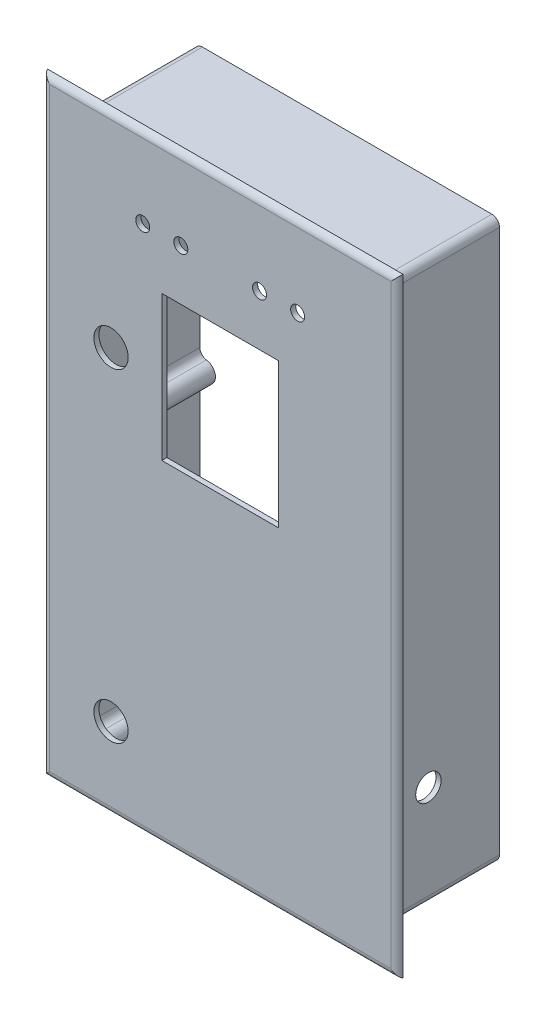
from build123d import *

# Parameters (mm, degrees)
SKETCH1_W           = 120
SKETCH1_H           = 220
BOSS_EXTRUDE1_DEPTH = 48
SKETCH2_W           = 140
SKETCH2_H           = 240
BOSS_EXTRUDE2_DEPTH = 2
SHELL3_DEPTH        = 48
FILLET1_R           = 3
SKETCH4_R           = 2.75
SKETCH4_R_2         = 6.75
SKETCH4_W           = 46
SKETCH4_H           = 57
CUT_EXTRUDE1_DEPTH  = 147.982992213
SKETCH6_R           = 1.2
BOSS_EXTRUDE3_DEPTH = 15
SKETCH7_R           = 2.5
BOSS_EXTRUDE4_DEPTH = 8
CUT_EXTRUDE2_REACH  = 185.848
SKETCH9_R           = 5
CUT_EXTRUDE3_REACH  = 185.848
SKETCH10_R          = 5
CUT_EXTRUDE4_REACH  = 247.561
SKETCH11_R          = 6.75
FILLET2_R           = 3
FILLET3_R           = 3


# Read off the part's stored shape, not the designer's step: Ø3.0mm Dowel Hole1, Shell3
with BuildPart() as part:
    # Sketch1 → Boss-Extrude1 (new body)
    with BuildSketch(Plane.XY):
        Rectangle(SKETCH1_W, SKETCH1_H)
    extrude(amount=BOSS_EXTRUDE1_DEPTH)

    # Sketch2 → Boss-Extrude2 (add)
    with BuildSketch(Plane.XY.offset(48)):
        Rectangle(SKETCH2_W, SKETCH2_H)
    extrude(amount=BOSS_EXTRUDE2_DEPTH)

    # Ø3.0mm Dowel Hole1 outline → Ø3.0mm Dowel Hole1 (revolve, cut)
    with BuildSketch(Plane(origin=(-56, 0, 0), x_dir=(1, 0, 0), z_dir=(0, -1, 0))):
        Polygon((2.125, 48), (0, 49.276828815), (0, 0), (2.125, 0), align=None)
    revolve(axis=Axis((-56, 0, 0), (0, 0, 1)), mode=Mode.SUBTRACT)

    # 3.0mm Dowel Hole1 2 outline → 3.0mm Dowel Hole1 2 (revolve, cut)
    with BuildSketch(Plane(origin=(56, 0, 0), x_dir=(1, 0, 0), z_dir=(0, -1, 0))):
        Polygon((2.125, 48), (0, 49.276828815), (0, 0), (2.125, 0), align=None)
    revolve(axis=Axis((56, 0, 0), (0, 0, 1)), mode=Mode.SUBTRACT)

    # 3.0mm Dowel Hole1 3 outline → 3.0mm Dowel Hole1 3 (revolve, cut)
    with BuildSketch(Plane(origin=(-56, -106, 0), x_dir=(1, 0, 0), z_dir=(0, -1, 0))):
        Polygon((2.125, 48), (0, 49.276828815), (0, 0), (2.125, 0), align=None)
    revolve(axis=Axis((-56, -106, 0), (0, 0, 1)), mode=Mode.SUBTRACT)

    # 3.0mm Dowel Hole1 4 outline → 3.0mm Dowel Hole1 4 (revolve, cut)
    with BuildSketch(Plane(origin=(56, -106, 0), x_dir=(1, 0, 0), z_dir=(0, -1, 0))):
        Polygon((2.125, 48), (0, 49.276828815), (0, 0), (2.125, 0), align=None)
    revolve(axis=Axis((56, -106, 0), (0, 0, 1)), mode=Mode.SUBTRACT)

    # 3.0mm Dowel Hole1 5 outline → 3.0mm Dowel Hole1 5 (revolve, cut)
    with BuildSketch(Plane(origin=(-56, 106, 0), x_dir=(1, 0, 0), z_dir=(0, -1, 0))):
        Polygon((2.125, 48), (0, 49.276828815), (0, 0), (2.125, 0), align=None)
    revolve(axis=Axis((-56, 106, 0), (0, 0, 1)), mode=Mode.SUBTRACT)

    # 3.0mm Dowel Hole1 6 outline → 3.0mm Dowel Hole1 6 (revolve, cut)
    with BuildSketch(Plane(origin=(56, 106, 0), x_dir=(1, 0, 0), z_dir=(0, -1, 0))):
        Polygon((2.125, 48), (0, 49.276828815), (0, 0), (2.125, 0), align=None)
    revolve(axis=Axis((56, 106, 0), (0, 0, 1)), mode=Mode.SUBTRACT)

    # Shell3 outline → Shell3 (cut)
    with BuildSketch(Plane.XY):
        with BuildLine():
            Line((52.392282578, 108), (-52.392282578, 108))
            ThreePointArc((-52.392282578, 108), (-53.083184528, 103.083184528), (-58, 102.392282578))
            Line((-58, 102.392282578), (-58, 3.607717422))
            ThreePointArc((-58, 3.607717422), (-51.875, 0), (-58, -3.607717422))
            Line((-58, -3.607717422), (-58, -102.392282578))
            ThreePointArc((-58, -102.392282578), (-53.083184528, -103.083184528), (-52.392282578, -108))
            Line((-52.392282578, -108), (52.392282578, -108))
            ThreePointArc((52.392282578, -108), (53.083184528, -103.083184528), (58, -102.392282578))
            Line((58, -102.392282578), (58, -3.607717422))
            ThreePointArc((58, -3.607717422), (51.875, 0), (58, 3.607717422))
            Line((58, 3.607717422), (58, 102.392282578))
            ThreePointArc((58, 102.392282578), (53.083184528, 103.083184528), (52.392282578, 108))
        make_face()
    extrude(amount=SHELL3_DEPTH, mode=Mode.SUBTRACT)

    # Fillet1
    fillet1_edges = [part.edges().sort_by_distance(p)[0] for p in [
        (-52.392282578, 108, 24),
        (-58, 3.607717422, 24),
        (58, -3.607717422, 24),
        (52.392282578, -108, 24),
        (58, 102.392282578, 24),
        (-58, -102.392282578, 24),
        (-58, -3.607717422, 24),
        (58, 3.607717422, 24),
        (-52.392282578, -108, 24),
        (58, -102.392282578, 24),
        (-58, 102.392282578, 24),
        (52.392282578, 108, 24),
    ]]
    fillet(fillet1_edges, radius=FILLET1_R)

    # Sketch4 → Cut-Extrude1 (cut, through all)
    with BuildSketch(Plane(origin=(0, 0, 48), x_dir=(-1, 0, 0), z_dir=(0, 0, -1))):
        with Locations((15.5, 88)):
            Circle(SKETCH4_R)
        with Locations(Location((30.5, 88, 0), (0, 0, 180))):
            Circle(SKETCH4_R)
        with Locations((-30.5, 88)):
            Circle(SKETCH4_R)
        with Locations(Location((-15.5, 88, 0), (0, 0, 180))):
            Circle(SKETCH4_R)
        with Locations((43, 39.5)):
            Circle(SKETCH4_R_2)
        with Locations((43, -88)):
            Circle(SKETCH4_R_2)
        with Locations((0, 39.5)):
            Rectangle(SKETCH4_W, SKETCH4_H)
    extrude(amount=-CUT_EXTRUDE1_DEPTH, mode=Mode.SUBTRACT)

    # Sketch6 → Boss-Extrude3 (add)
    with BuildSketch(Plane(origin=(0, 0, 48), x_dir=(-1, 0, 0), z_dir=(0, 0, -1))):
        with Locations(Location((-45.079, -23.120003999, 0), (0, 0, 180))):
            Circle(SKETCH6_R)
        with Locations(Location((24.517, -23.120003999, 0), (0, 0, 180))):
            Circle(SKETCH6_R)
        with Locations(Location((-45.079, -92.589003999, 0), (0, 0, 180))):
            Circle(SKETCH6_R)
        with Locations(Location((24.517, -92.589003999, 0), (0, 0, 180))):
            Circle(SKETCH6_R)
    extrude(amount=BOSS_EXTRUDE3_DEPTH)

    # Sketch7 → Boss-Extrude4 (add)
    with BuildSketch(Plane(origin=(0, 0, 48), x_dir=(-1, 0, 0), z_dir=(0, 0, -1))):
        with Locations(Location((-45.079, -23.120003999, 0), (0, 0, 180))):
            Circle(SKETCH7_R)
        with Locations(Location((24.517, -23.120003999, 0), (0, 0, 180))):
            Circle(SKETCH7_R)
        with Locations(Location((24.517, -92.589003999, 0), (0, 0, 180))):
            Circle(SKETCH7_R)
        with Locations(Location((-45.079, -92.589003999, 0), (0, 0, 180))):
            Circle(SKETCH7_R)
    extrude(amount=BOSS_EXTRUDE4_DEPTH)

    # Sketch9 → Cut-Extrude2 (cut, up to next)
    with BuildSketch(Plane(origin=(60, 0, 0), x_dir=(0, 0, -1), z_dir=(1, 0, 0)), mode=Mode.PRIVATE) as cut_extrude2_sk1:
        with Locations((-28, -70)):
            Circle(SKETCH9_R)
    cut_extrude2_tool1 = extrude(cut_extrude2_sk1.sketch, amount=-CUT_EXTRUDE2_REACH, mode=Mode.PRIVATE) & part.part
    add(cut_extrude2_tool1.solids().sort_by_distance((60, -70, 28))[0], mode=Mode.SUBTRACT)

    # Sketch10 → Cut-Extrude3 (cut, up to next)
    with BuildSketch(Plane.ZY.offset(60), mode=Mode.PRIVATE) as cut_extrude3_sk1:
        with Locations((28, -40)):
            Circle(SKETCH10_R)
    cut_extrude3_tool1 = extrude(cut_extrude3_sk1.sketch, amount=-CUT_EXTRUDE3_REACH, mode=Mode.PRIVATE) & part.part
    add(cut_extrude3_tool1.solids().sort_by_distance((-60, -40, 28))[0], mode=Mode.SUBTRACT)

    # Sketch11 → Cut-Extrude4 (cut, up to next)
    with BuildSketch(Plane.XZ.offset(110), mode=Mode.PRIVATE) as cut_extrude4_sk1:
        with Locations(Location((0, 30, 0), (0, 0, 270))):
            Circle(SKETCH11_R)
    cut_extrude4_tool1 = extrude(cut_extrude4_sk1.sketch, amount=-CUT_EXTRUDE4_REACH, mode=Mode.PRIVATE) & part.part
    add(cut_extrude4_tool1.solids().sort_by_distance((0, -110, 30))[0], mode=Mode.SUBTRACT)

    # Fillet2
    fillet2_edges = [part.edges().sort_by_distance(p)[0] for p in [
        (60, -110, 24),
        (-60, -110, 24),
        (-60, 110, 24),
        (60, 110, 24),
    ]]
    fillet(fillet2_edges, radius=FILLET2_R)

    # Fillet3
    # the kernel refuses this fillet: 3 mm, written as the material it takes off along each edge
    with BuildSketch(Plane(origin=(77.071067812, -120, 50), x_dir=(0, 0, -1), z_dir=(-1, 0, 0)), Plane(origin=(-77.071067812, 120, 50), x_dir=(0, 0, -1), z_dir=(1, 0, 0))) as fillet3_piece_1:
        with BuildLine():
            CenterArc((3, -2.828427125), FILLET3_R, 109.471220634, 70.528779366)
            Line((0, -2.828427125), (-0.06, -2.828427125))
            Line((-0.06, -2.828427125), (-0.06, 0))
            Line((-0.06, 0), (0, 0.06))
            ThreePointArc((0, 0.06), (1, 0.06), (1.98, 0.056568542))
            Line((1.98, 0.056568542), (2, 0))
        make_face()
    extrude(amount=154.142135624, mode=Mode.SUBTRACT)
    with BuildSketch(Plane(origin=(-70, -127.071067812, 50), x_dir=(0, 0, -1), z_dir=(0, 1, 0)), Plane(origin=(70, 127.071067812, 50), x_dir=(0, 0, -1), z_dir=(0, -1, 0))) as fillet3_piece_2:
        with BuildLine():
            CenterArc((3, -2.828427125), FILLET3_R, 109.471220634, 70.528779366)
            Line((0, -2.828427125), (-0.06, -2.828427125))
            Line((-0.06, -2.828427125), (-0.06, 0))
            Line((-0.06, 0), (0, 0.06))
            ThreePointArc((0, 0.06), (1, 0.06), (1.98, 0.056568542))
            Line((1.98, 0.056568542), (2, 0))
        make_face()
    extrude(amount=254.142135624, mode=Mode.SUBTRACT)


solid = part.part
